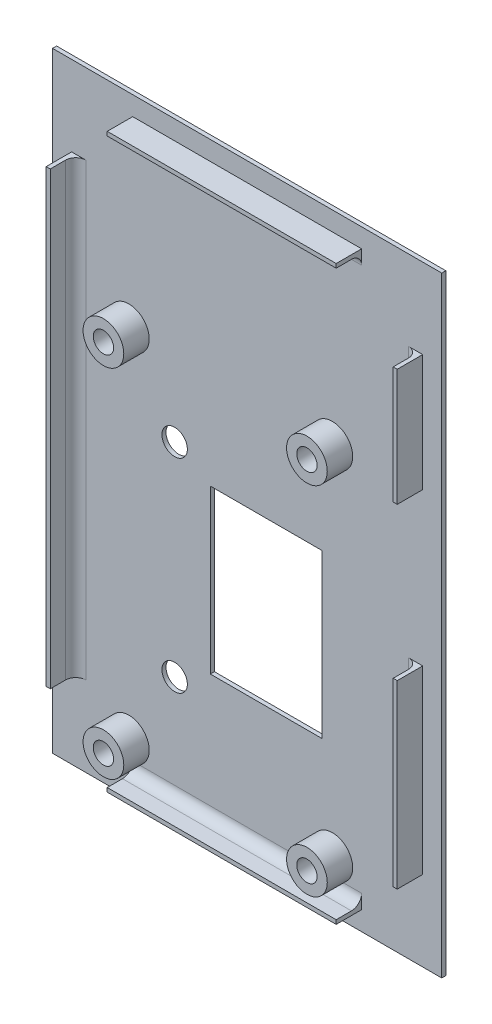
from build123d import *

# Parameters (mm, degrees)
SKETCH_1_W          = 76.5
SKETCH_1_H          = 120
EXTRUDE_1_DEPTH     = 0.8
SKETCH_5_R          = 2.5
CUT_EXTRUDE_2_DEPTH = 143.31264877
SKETCH_7_R          = 4
SKETCH_7_R_2        = 2
EXTRUDE_2_DEPTH     = 5
SKETCH_8_W          = 22
SKETCH_8_H          = 32
CUT_EXTRUDE_4_DEPTH = 143.398209258
SKETCH_9_R          = 2
CUT_EXTRUDE_5_DEPTH = 143.398209258
SKETCH_10_W         = 69
SKETCH_10_H         = 112.5
SKETCH_10_W_2       = 67.4
SKETCH_10_H_2       = 110.9
EXTRUDE_4_DEPTH     = 5
SKETCH_11_W         = 0.8
SKETCH_11_H         = 30
CUT_EXTRUDE_6_DEPTH = 5
FILLET_1_R          = 2


with BuildPart() as part:
    # ｽｹｯﾁ1 → ﾎﾞｽ - 押し出し1 (new body)
    with BuildSketch(Plane.XY):
        with Locations((38.25, 60)):
            Rectangle(SKETCH_1_W, SKETCH_1_H)
    extrude(amount=EXTRUDE_1_DEPTH)

    # ｽｹｯﾁ5 → ｶｯﾄ - 押し出し2 (cut, through all)
    with BuildSketch(Plane.XY.offset(0.8)):
        with Locations((24, 65)):
            Circle(SKETCH_5_R)
        with Locations((24, 25)):
            Circle(SKETCH_5_R)
    extrude(amount=-CUT_EXTRUDE_2_DEPTH, mode=Mode.SUBTRACT)

    # ｽｹｯﾁ7 → ﾎﾞｽ - 押し出し2 (add)
    # profile 1 of 4: a face of its own
    with BuildSketch(Plane.XY.offset(0.8)):
        with Locations(Location((55, 80, 0), (0, 0, 180))):
            Circle(SKETCH_7_R)
        with Locations((55, 80)):
            Circle(SKETCH_7_R_2, mode=Mode.SUBTRACT)
    # profile 2 of 4: a face of its own
    with BuildSketch(Plane.XY.offset(0.8)):
        with Locations(Location((15, 80, 0), (0, 0, 180))):
            Circle(SKETCH_7_R)
        with Locations((15, 80)):
            Circle(SKETCH_7_R_2, mode=Mode.SUBTRACT)
    # profile 3 of 4: a face of its own
    with BuildSketch(Plane.XY.offset(0.8)):
        with Locations(Location((55, 10, 0), (0, 0, 180))):
            Circle(SKETCH_7_R)
        with Locations((55, 10)):
            Circle(SKETCH_7_R_2, mode=Mode.SUBTRACT)
    # profile 4 of 4: a face of its own
    with BuildSketch(Plane.XY.offset(0.8)):
        with Locations(Location((15, 10, 0), (0, 0, 180))):
            Circle(SKETCH_7_R)
        with Locations((15, 10)):
            Circle(SKETCH_7_R_2, mode=Mode.SUBTRACT)
    extrude(amount=EXTRUDE_2_DEPTH)

    # ｽｹｯﾁ8 → ｶｯﾄ - 押し出し4 (cut, through all)
    with BuildSketch(Plane.XY.offset(0.8)):
        with Locations((42, 45)):
            Rectangle(SKETCH_8_W, SKETCH_8_H)
    extrude(amount=-CUT_EXTRUDE_4_DEPTH, mode=Mode.SUBTRACT)

    # ｽｹｯﾁ9 → ｶｯﾄ - 押し出し5 (cut, through all)
    with BuildSketch(Plane.XY.offset(0.8)):
        with Locations((15, 80)):
            Circle(SKETCH_9_R)
        with Locations((55, 80)):
            Circle(SKETCH_9_R)
        with Locations((55, 10)):
            Circle(SKETCH_9_R)
        with Locations((15, 10)):
            Circle(SKETCH_9_R)
    extrude(amount=-CUT_EXTRUDE_5_DEPTH, mode=Mode.SUBTRACT)

    # ｽｹｯﾁ10 → ﾎﾞｽ - 押し出し4 (add)
    with BuildSketch(Plane.XY.offset(0.8)):
        with Locations((38.25, 60)):
            Rectangle(SKETCH_10_W, SKETCH_10_H)
        with Locations((38.25, 60)):
            Rectangle(SKETCH_10_W_2, SKETCH_10_H_2, mode=Mode.SUBTRACT)
    extrude(amount=EXTRUDE_4_DEPTH)

    # ｽｹｯﾁ11 → ｶｯﾄ - 押し出し6 (cut)
    with BuildSketch(Plane.XY.offset(5.8)):
        with Locations((72.35, 66.25)):
            Rectangle(SKETCH_11_W, SKETCH_11_H)
        Polygon((3.75, 116.25), (15.75, 116.25), (15.75, 115.45), (4.55, 115.45), (4.55, 104.25), (3.75, 104.25), align=None)
        Polygon((72.75, 104.25), (72.75, 116.25), (60.75, 116.25), (60.75, 115.45), (71.95, 115.45), (71.95, 104.25), align=None)
        Polygon((72.75, 3.75), (72.75, 15.75), (71.95, 15.75), (71.95, 4.55), (60.75, 4.55), (60.75, 3.75), align=None)
        Polygon((3.75, 3.75), (15.75, 3.75), (15.75, 4.55), (4.55, 4.55), (4.55, 15.75), (3.75, 15.75), align=None)
    extrude(amount=-CUT_EXTRUDE_6_DEPTH, mode=Mode.SUBTRACT)

    # ﾌｨﾚｯﾄ1
    # the kernel refuses this fillet: 2 mm, written as the material it adds along each edge
    with BuildSketch(Plane(origin=(60.75, 4.55, 0.8), x_dir=(0, 1, 0), z_dir=(-1, 0, 0)), Plane(origin=(15.75, 115.45, 0.8), x_dir=(0, -1, 0), z_dir=(1, 0, 0))) as fillet_1_piece_1:
        with BuildLine():
            CenterArc((FILLET_1_R, -FILLET_1_R), FILLET_1_R, 90, 90)
            Line((0, -FILLET_1_R), (0, 0))
            Line((0, 0), (FILLET_1_R, 0))
        make_face()
    extrude(amount=45)
    with BuildSketch(Plane(origin=(4.55, 15.75, 0.8), x_dir=(1, 0, 0), z_dir=(0, 1, 0))) as fillet_1_piece_2:
        with BuildLine():
            CenterArc((FILLET_1_R, -FILLET_1_R), FILLET_1_R, 90, 90)
            Line((0, -FILLET_1_R), (0, 0))
            Line((0, 0), (FILLET_1_R, 0))
        make_face()
    extrude(amount=88.5)
    with BuildSketch(Plane(origin=(71.95, 51.25, 0.8), x_dir=(-1, 0, 0), z_dir=(0, -1, 0))) as fillet_1_piece_3:
        with BuildLine():
            CenterArc((FILLET_1_R, -FILLET_1_R), FILLET_1_R, 90, 90)
            Line((0, -FILLET_1_R), (0, 0))
            Line((0, 0), (FILLET_1_R, 0))
        make_face()
    extrude(amount=35.5)
    with BuildSketch(Plane(origin=(71.95, 104.25, 0.8), x_dir=(-1, 0, 0), z_dir=(0, -1, 0))) as fillet_1_piece_4:
        with BuildLine():
            CenterArc((FILLET_1_R, -FILLET_1_R), FILLET_1_R, 90, 90)
            Line((0, -FILLET_1_R), (0, 0))
            Line((0, 0), (FILLET_1_R, 0))
        make_face()
    extrude(amount=23)


solid = part.part
